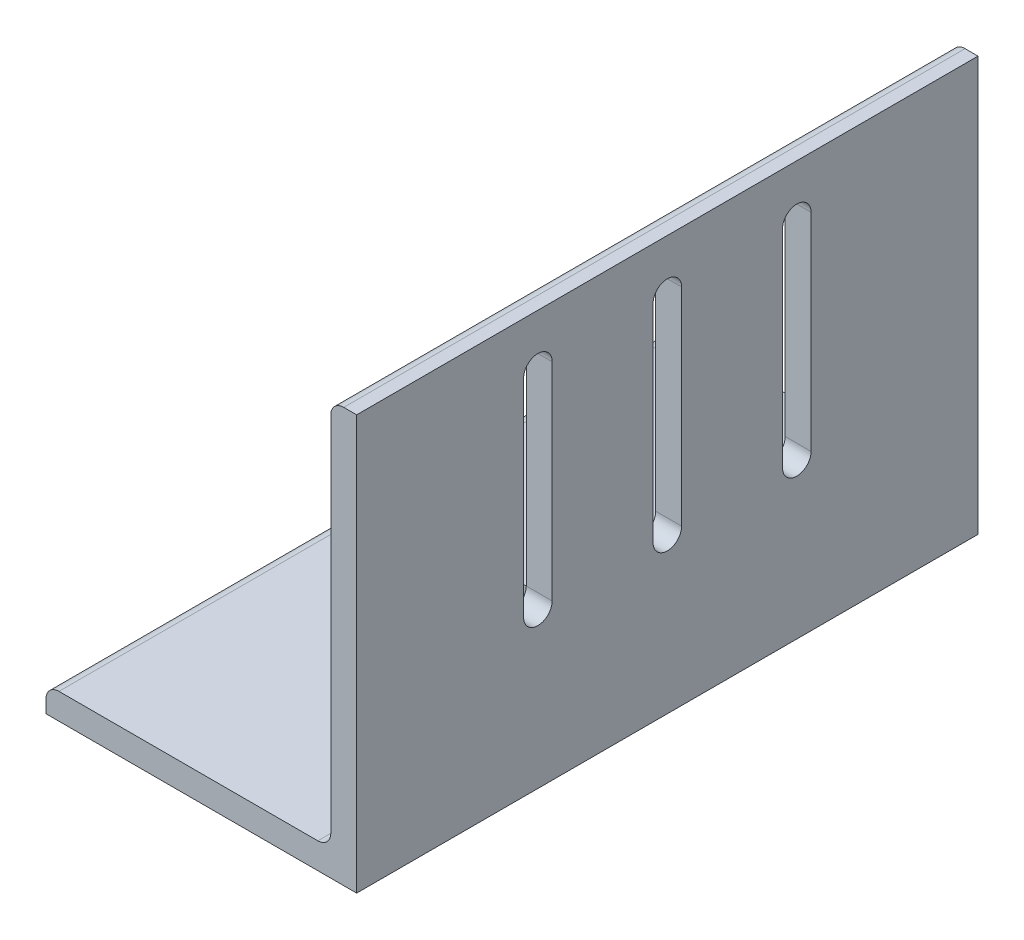
from build123d import *

# Parameters (mm, degrees)
BOSS_EXTRUDE1_DEPTH = 76.2
CUT_EXTRUDE1_DEPTH  = 10
SKETCH4_R           = 3.5
CUT_EXTRUDE2_DEPTH  = 10


with BuildPart() as part:
    # Sketch2 → Boss-Extrude1 (new, symmetric)
    with BuildSketch(Plane.XY):
        with BuildLine():
            Line((-38.1, 0), (38.1, 0))
            Line((38.1, 0), (38.1, 101.6))
            Line((38.1, 101.6), (34.925, 101.6))
            ThreePointArc((34.925, 101.6), (32.67993597, 100.67006403), (31.75, 98.425))
            Line((31.75, 98.425), (31.75, 9.525))
            ThreePointArc((31.75, 9.525), (30.82006403, 7.27993597), (28.575, 6.35))
            Line((28.575, 6.35), (-34.925, 6.35))
            ThreePointArc((-34.925, 6.35), (-37.17006403, 5.42006403), (-38.1, 3.175))
            Line((-38.1, 3.175), (-38.1, 0))
        make_face()
    extrude(amount=BOSS_EXTRUDE1_DEPTH, both=True)

    # Sketch3 → Cut-Extrude1 (cut)
    with BuildSketch(Plane(origin=(38.1, 0, 0), x_dir=(0, 0, -1), z_dir=(1, 0, 0))):
        with BuildLine():
            Line((-28.25, 88.9), (-28.25, 38.1))
            ThreePointArc((-28.25, 38.1), (-31.75, 34.6), (-35.25, 38.1))
            Line((-35.25, 38.1), (-35.25, 88.9))
            ThreePointArc((-35.25, 88.9), (-31.75, 92.4), (-28.25, 88.9))
        make_face()
        with BuildLine():
            Line((28.25, 88.9), (28.25, 38.1))
            ThreePointArc((28.25, 38.1), (31.75, 34.6), (35.25, 38.1))
            Line((35.25, 38.1), (35.25, 88.9))
            ThreePointArc((35.25, 88.9), (31.75, 92.4), (28.25, 88.9))
        make_face()
        with BuildLine():
            Line((3.5, 88.9), (3.5, 38.1))
            ThreePointArc((3.5, 38.1), (0, 34.6), (-3.5, 38.1))
            Line((-3.5, 38.1), (-3.5, 88.9))
            ThreePointArc((-3.5, 88.9), (0, 92.4), (3.5, 88.9))
        make_face()
    extrude(amount=-CUT_EXTRUDE1_DEPTH, mode=Mode.SUBTRACT)

    # Sketch4 → Cut-Extrude2 (cut)
    with BuildSketch(Plane.XZ):
        with Locations((0, 25.4)):
            Circle(SKETCH4_R)
        with Locations((0, -25.4)):
            Circle(SKETCH4_R)
        Circle(SKETCH4_R)
    extrude(amount=-CUT_EXTRUDE2_DEPTH, mode=Mode.SUBTRACT)


solid = part.part
